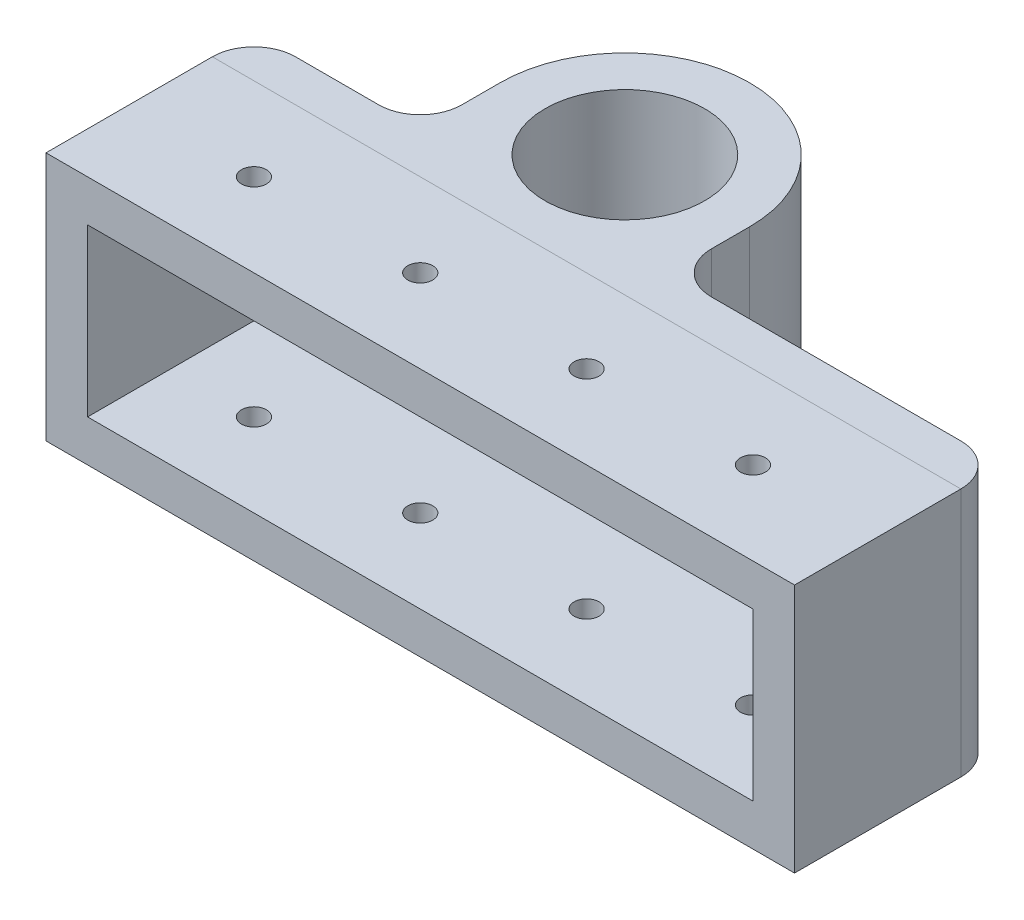
from build123d import *

# Parameters (mm, degrees)
ESQUISSE1_W             = 90
ESQUISSE1_H             = 30
ESQUISSE1_W_2           = 80
ESQUISSE1_H_2           = 20
BOSS_EXTRU_1_DEPTH      = 20
ENL_V_MAT_EXTRU_1_DEPTH = 30
ESQUISSE2_R             = 9.6
BOSS_EXTRU_3_DEPTH      = 30
CONG_1_R                = 5
CONG_2_R                = 5


with BuildPart() as part:
    # Esquisse1 → Boss.-Extru.1 (new body)
    with BuildSketch(Plane.XY):
        Rectangle(ESQUISSE1_W, ESQUISSE1_H)
        Rectangle(ESQUISSE1_W_2, ESQUISSE1_H_2, mode=Mode.SUBTRACT)
    extrude(amount=BOSS_EXTRU_1_DEPTH)

    # Esquisse3 → Enlèv. mat.-Extru.1 (cut)
    with BuildSketch(Plane.XZ.offset(15)):
        with BuildLine():
            ThreePointArc((28.5, 10), (30, 8.5), (31.5, 10))
            Line((31.5, 10), (28.5, 10))
        make_face()
        with BuildLine():
            Line((28.5, 10), (31.5, 10))
            ThreePointArc((31.5, 10), (30, 11.5), (28.5, 10))
        make_face()
        with BuildLine():
            ThreePointArc((8.5, 10), (10, 8.5), (11.5, 10))
            Line((11.5, 10), (8.5, 10))
        make_face()
        with BuildLine():
            Line((8.5, 10), (11.5, 10))
            ThreePointArc((11.5, 10), (10, 11.5), (8.5, 10))
        make_face()
        with BuildLine():
            ThreePointArc((-8.5, 10), (-10, 11.5), (-11.5, 10))
            Line((-11.5, 10), (-8.5, 10))
        make_face()
        with BuildLine():
            Line((-8.5, 10), (-11.5, 10))
            ThreePointArc((-11.5, 10), (-10, 8.5), (-8.5, 10))
        make_face()
        with BuildLine():
            ThreePointArc((-28.5, 10), (-30, 11.5), (-31.5, 10))
            Line((-31.5, 10), (-28.5, 10))
        make_face()
        with BuildLine():
            Line((-28.5, 10), (-31.5, 10))
            ThreePointArc((-31.5, 10), (-30, 8.5), (-28.5, 10))
        make_face()
    extrude(amount=-ENL_V_MAT_EXTRU_1_DEPTH, mode=Mode.SUBTRACT)


with BuildPart() as body_2:
    # Esquisse2 → Boss.-Extru.3 (new body)
    with BuildSketch(Plane(origin=(0, 15, 0), x_dir=(1, 0, 0), z_dir=(0, 1, 0))):
        with BuildLine():
            Line((-45, 5), (-45, 0))
            Line((-45, 0), (45, 0))
            Line((45, 0), (45, 5))
            Line((45, 5), (5, 5))
            Line((5, 5), (5, 14.6))
            ThreePointArc((5, 14.6), (-10, 29.6), (-25, 14.6))
            Line((-25, 14.6), (-25, 5))
            Line((-25, 5), (-45, 5))
        make_face()
        with Locations(Location((-10, 14.6, 0), (0, 0, 180))):
            Circle(ESQUISSE2_R, mode=Mode.SUBTRACT)
    extrude(amount=-BOSS_EXTRU_3_DEPTH)

    # Congé1
    cong_1_edges = [body_2.edges().sort_by_distance(p)[0] for p in [
        (-25, 0, -5),
        (5, 0, -5),
    ]]
    fillet(cong_1_edges, radius=CONG_1_R)

    # Congé2
    cong_2_edges = [body_2.edges().sort_by_distance(p)[0] for p in [
        (-45, 0, -5),
        (45, 0, -5),
    ]]
    fillet(cong_2_edges, radius=CONG_2_R - 0.0001)  # a hair under: the kernel refuses the full size


solid = Compound([part.part, body_2.part])
